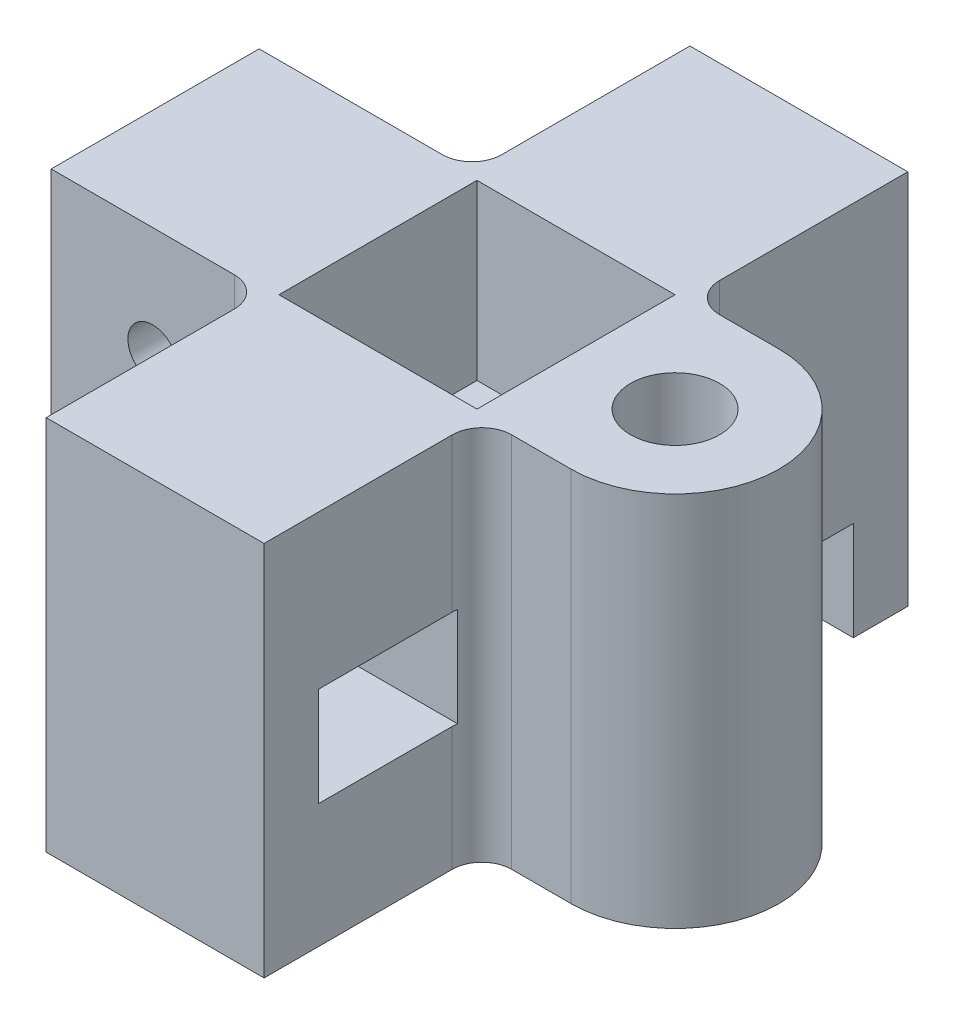
from build123d import *

# Parameters (mm, degrees)
SKETCH1_W               = 65
SKETCH1_H               = 65
SKETCH1_R               = 2.5
BOSS_EXTRUDE1_DEPTH     = 38
SKETCH3_W               = 21.5
SKETCH3_H               = 22
CUT_EXTRUDE2_DEPTH      = 60.636398282
CUT_EXTRUDE3_DEPTH      = 60.636398282
CUT_EXTRUDE3_DEPTH_BACK = 60.636398282
SKETCH4_R               = 2.5
CUT_EXTRUDE4_DEPTH      = 60.636398282
CUT_EXTRUDE4_DEPTH_BACK = 60.636398282
SKETCH6_W               = 14
SKETCH6_H               = 10
SKETCH7_W               = 20
SKETCH7_H               = 20
CUT_EXTRUDE5_DEPTH      = 17.5
FILLET1_R               = 3
SKETCH8_R               = 4.5
CUT_EXTRUDE6_DEPTH      = 23


with BuildPart() as part:
    # Sketch1 → Boss-Extrude1 (new body)
    with BuildSketch(Plane(origin=(0, 0, 0), x_dir=(1, 0, 0), z_dir=(0, 1, 0))):
        Rectangle(SKETCH1_W, SKETCH1_H)
        with Locations(Location((0, 0, 0), (0, 0, 270))):
            Circle(SKETCH1_R, mode=Mode.SUBTRACT)
        with Locations(Location((20, 0, 0), (0, 0, 270))):
            Circle(SKETCH1_R, mode=Mode.SUBTRACT)
    extrude(amount=BOSS_EXTRUDE1_DEPTH)

    # Sketch3 → Cut-Extrude2 (cut, through all)
    with BuildSketch(Plane(origin=(0, 38, 0), x_dir=(1, 0, 0), z_dir=(0, 1, 0))):
        with Locations((-21.75, 21.5)):
            Rectangle(SKETCH3_W, SKETCH3_H)
        with BuildLine():
            Line((11, 32.5), (32.5, 32.5))
            Line((32.5, 32.5), (32.5, -32.5))
            Line((32.5, -32.5), (11, -32.5))
            Line((11, -32.5), (11, -10.5))
            Line((11, -10.5), (20, -10.5))
            ThreePointArc((20, -10.5), (30.5, 0), (20, 10.5))
            Line((20, 10.5), (11, 10.5))
            Line((11, 10.5), (11, 32.5))
        make_face()
        with Locations((-21.75, -21.5)):
            Rectangle(SKETCH3_W, SKETCH3_H)
    extrude(amount=-CUT_EXTRUDE2_DEPTH, mode=Mode.SUBTRACT)

    # Sketch4 → Cut-Extrude3 (cut, two sides: drawn at the far end of the back side and taken through both)
    with BuildSketch(Plane.XY.offset(-CUT_EXTRUDE3_DEPTH_BACK)):
        with Locations((-22.25, 27)):
            Circle(SKETCH4_R)
    extrude(amount=CUT_EXTRUDE3_DEPTH + CUT_EXTRUDE3_DEPTH_BACK, mode=Mode.SUBTRACT)

    # Sketch6 → Cut-Extrude4 (cut, two sides: drawn at the far end of the back side and taken through both)
    with BuildSketch(Plane(origin=(0, 0, 0), x_dir=(0, 0, -1), z_dir=(1, 0, 0)).offset(-CUT_EXTRUDE4_DEPTH_BACK)):
        with Locations((-20, 17.5)):
            Rectangle(SKETCH6_W, SKETCH6_H)
        with Locations((20, 5)):
            Rectangle(SKETCH6_W, SKETCH6_H)
    extrude(amount=CUT_EXTRUDE4_DEPTH + CUT_EXTRUDE4_DEPTH_BACK, mode=Mode.SUBTRACT)

    # Sketch7 → Cut-Extrude5 (cut)
    with BuildSketch(Plane(origin=(0, 38, 0), x_dir=(1, 0, 0), z_dir=(0, 1, 0))):
        Rectangle(SKETCH7_W, SKETCH7_H)
    extrude(amount=-CUT_EXTRUDE5_DEPTH, mode=Mode.SUBTRACT)

    # Fillet1
    # the kernel refuses this fillet: 3 mm, written as the material it adds along each edge
    with BuildSketch(Plane(origin=(11, 38, -10.5), x_dir=(0, 0, -1), z_dir=(0, -1, 0))) as fillet1_piece_1_section:
        with BuildLine():
            CenterArc((FILLET1_R, FILLET1_R), FILLET1_R, 180, 90)
            Line((0, FILLET1_R), (0, 0))
            Line((0, 0), (FILLET1_R, 0))
        make_face()
    fillet1_piece_1 = extrude(amount=38, mode=Mode.PRIVATE)
    fillet1_piece_1 = split(fillet1_piece_1, bisect_by=Plane(origin=(10.978029732, 10, -13.226390424), z_dir=(0, 1, 0)), keep=Keep.TOP, mode=Mode.PRIVATE)
    fillet1_piece_1 = split(fillet1_piece_1, bisect_by=Plane(origin=(10.978029732, 24, -13), z_dir=(0, 0, -1)), keep=Keep.TOP, mode=Mode.PRIVATE)
    add(fillet1_piece_1)
    with BuildSketch(Plane(origin=(11, 38, -10.5), x_dir=(0, 0, -1), z_dir=(0, -1, 0))) as fillet1_piece_2_section:
        with BuildLine():
            CenterArc((FILLET1_R, FILLET1_R), FILLET1_R, 180, 90)
            Line((0, FILLET1_R), (0, 0))
            Line((0, 0), (FILLET1_R, 0))
        make_face()
    fillet1_piece_2 = extrude(amount=38, mode=Mode.PRIVATE)
    fillet1_piece_2 = split(fillet1_piece_2, bisect_by=Plane(origin=(11.690666213, 10, -11.145663974), z_dir=(0, 1, 0)), keep=Keep.TOP, mode=Mode.PRIVATE)
    fillet1_piece_2 = split(fillet1_piece_2, bisect_by=Plane(origin=(11.690666213, 24, -13), z_dir=(0, 0, 1)), keep=Keep.TOP, mode=Mode.PRIVATE)
    add(fillet1_piece_2)
    with BuildSketch(Plane(origin=(11, 38, -10.5), x_dir=(0, 0, -1), z_dir=(0, -1, 0))) as fillet1_piece_3_section:
        with BuildLine():
            CenterArc((FILLET1_R, FILLET1_R), FILLET1_R, 180, 90)
            Line((0, FILLET1_R), (0, 0))
            Line((0, 0), (FILLET1_R, 0))
        make_face()
    fillet1_piece_3 = extrude(amount=38, mode=Mode.PRIVATE)
    fillet1_piece_3 = split(fillet1_piece_3, bisect_by=Plane(origin=(11.690666213, 10, -11.145663974), z_dir=(0, -1, 0)), keep=Keep.TOP, mode=Mode.PRIVATE)
    fillet1_piece_3 = split(fillet1_piece_3, bisect_by=Plane(origin=(11.690666213, 5, -13), z_dir=(0, 0, 1)), keep=Keep.TOP, mode=Mode.PRIVATE)
    add(fillet1_piece_3)
    with BuildSketch(Plane(origin=(11, 38, 10.5), x_dir=(1, 0, 0), z_dir=(0, -1, 0))) as fillet1_piece_4_section:
        with BuildLine():
            CenterArc((FILLET1_R, FILLET1_R), FILLET1_R, 180, 90)
            Line((0, FILLET1_R), (0, 0))
            Line((0, 0), (FILLET1_R, 0))
        make_face()
    fillet1_piece_4 = extrude(amount=38, mode=Mode.PRIVATE)
    fillet1_piece_4 = split(fillet1_piece_4, bisect_by=Plane(origin=(11.690666213, 22.5, 11.145663974), z_dir=(0, 1, 0)), keep=Keep.TOP, mode=Mode.PRIVATE)
    fillet1_piece_4 = split(fillet1_piece_4, bisect_by=Plane(origin=(11.690666213, 30.25, 13), z_dir=(0, 0, -1)), keep=Keep.TOP, mode=Mode.PRIVATE)
    add(fillet1_piece_4)
    with BuildSketch(Plane(origin=(11, 38, 10.5), x_dir=(1, 0, 0), z_dir=(0, -1, 0))) as fillet1_piece_5_section:
        with BuildLine():
            CenterArc((FILLET1_R, FILLET1_R), FILLET1_R, 180, 90)
            Line((0, FILLET1_R), (0, 0))
            Line((0, 0), (FILLET1_R, 0))
        make_face()
    fillet1_piece_5 = extrude(amount=38, mode=Mode.PRIVATE)
    fillet1_piece_5 = split(fillet1_piece_5, bisect_by=Plane(origin=(10.978029732, 22.5, 13.226390424), z_dir=(0, 1, 0)), keep=Keep.TOP, mode=Mode.PRIVATE)
    fillet1_piece_5 = split(fillet1_piece_5, bisect_by=Plane(origin=(10.978029732, 30.25, 13), z_dir=(0, 0, 1)), keep=Keep.TOP, mode=Mode.PRIVATE)
    add(fillet1_piece_5)
    with BuildSketch(Plane(origin=(11, 38, 10.5), x_dir=(1, 0, 0), z_dir=(0, -1, 0))) as fillet1_piece_6_section:
        with BuildLine():
            CenterArc((FILLET1_R, FILLET1_R), FILLET1_R, 180, 90)
            Line((0, FILLET1_R), (0, 0))
            Line((0, 0), (FILLET1_R, 0))
        make_face()
    fillet1_piece_6 = extrude(amount=38, mode=Mode.PRIVATE)
    fillet1_piece_6 = split(fillet1_piece_6, bisect_by=Plane(origin=(11.690666213, 22.5, 11.145663974), z_dir=(0, -1, 0)), keep=Keep.TOP, mode=Mode.PRIVATE)
    fillet1_piece_6 = split(fillet1_piece_6, bisect_by=Plane(origin=(11.690666213, 12.5, 11.145663974), z_dir=(0, 1, 0)), keep=Keep.TOP, mode=Mode.PRIVATE)
    fillet1_piece_6 = split(fillet1_piece_6, bisect_by=Plane(origin=(11.690666213, 17.5, 13), z_dir=(0, 0, -1)), keep=Keep.TOP, mode=Mode.PRIVATE)
    add(fillet1_piece_6)
    with BuildSketch(Plane(origin=(11, 38, 10.5), x_dir=(1, 0, 0), z_dir=(0, -1, 0))) as fillet1_piece_7_section:
        with BuildLine():
            CenterArc((FILLET1_R, FILLET1_R), FILLET1_R, 180, 90)
            Line((0, FILLET1_R), (0, 0))
            Line((0, 0), (FILLET1_R, 0))
        make_face()
    fillet1_piece_7 = extrude(amount=38, mode=Mode.PRIVATE)
    fillet1_piece_7 = split(fillet1_piece_7, bisect_by=Plane(origin=(11.690666213, 12.5, 11.145663974), z_dir=(0, -1, 0)), keep=Keep.TOP, mode=Mode.PRIVATE)
    fillet1_piece_7 = split(fillet1_piece_7, bisect_by=Plane(origin=(11.690666213, 6.25, 13), z_dir=(0, 0, -1)), keep=Keep.TOP, mode=Mode.PRIVATE)
    add(fillet1_piece_7)
    with BuildSketch(Plane(origin=(11, 38, 10.5), x_dir=(1, 0, 0), z_dir=(0, -1, 0))) as fillet1_piece_8_section:
        with BuildLine():
            CenterArc((FILLET1_R, FILLET1_R), FILLET1_R, 180, 90)
            Line((0, FILLET1_R), (0, 0))
            Line((0, 0), (FILLET1_R, 0))
        make_face()
    fillet1_piece_8 = extrude(amount=38, mode=Mode.PRIVATE)
    fillet1_piece_8 = split(fillet1_piece_8, bisect_by=Plane(origin=(10.978029732, 12.5, 13.226390424), z_dir=(0, -1, 0)), keep=Keep.TOP, mode=Mode.PRIVATE)
    fillet1_piece_8 = split(fillet1_piece_8, bisect_by=Plane(origin=(10.978029732, 6.25, 13), z_dir=(0, 0, 1)), keep=Keep.TOP, mode=Mode.PRIVATE)
    add(fillet1_piece_8)
    with BuildSketch(Plane(origin=(-11, 38, 10.5), x_dir=(-1, 0, 0), z_dir=(0, -1, 0))) as fillet1_piece_9_section:
        with BuildLine():
            CenterArc((FILLET1_R, -FILLET1_R), FILLET1_R, 90, 90)
            Line((0, -FILLET1_R), (0, 0))
            Line((0, 0), (FILLET1_R, 0))
        make_face()
    fillet1_piece_9 = extrude(amount=38, mode=Mode.PRIVATE)
    fillet1_piece_9 = split(fillet1_piece_9, bisect_by=Plane(origin=(-11.690666213, 22.5, 11.145663974), z_dir=(0, 1, 0)), keep=Keep.TOP, mode=Mode.PRIVATE)
    fillet1_piece_9 = split(fillet1_piece_9, bisect_by=Plane(origin=(-11.690666213, 30.25, 13), z_dir=(0, 0, -1)), keep=Keep.TOP, mode=Mode.PRIVATE)
    add(fillet1_piece_9)
    with BuildSketch(Plane(origin=(-11, 38, 10.5), x_dir=(-1, 0, 0), z_dir=(0, -1, 0))) as fillet1_piece_10_section:
        with BuildLine():
            CenterArc((FILLET1_R, -FILLET1_R), FILLET1_R, 90, 90)
            Line((0, -FILLET1_R), (0, 0))
            Line((0, 0), (FILLET1_R, 0))
        make_face()
    fillet1_piece_10 = extrude(amount=38, mode=Mode.PRIVATE)
    fillet1_piece_10 = split(fillet1_piece_10, bisect_by=Plane(origin=(-10.978029732, 22.5, 13.226390424), z_dir=(0, 1, 0)), keep=Keep.TOP, mode=Mode.PRIVATE)
    fillet1_piece_10 = split(fillet1_piece_10, bisect_by=Plane(origin=(-10.978029732, 30.25, 13), z_dir=(0, 0, 1)), keep=Keep.TOP, mode=Mode.PRIVATE)
    add(fillet1_piece_10)
    with BuildSketch(Plane(origin=(-11, 38, 10.5), x_dir=(-1, 0, 0), z_dir=(0, -1, 0))) as fillet1_piece_11_section:
        with BuildLine():
            CenterArc((FILLET1_R, -FILLET1_R), FILLET1_R, 90, 90)
            Line((0, -FILLET1_R), (0, 0))
            Line((0, 0), (FILLET1_R, 0))
        make_face()
    fillet1_piece_11 = extrude(amount=38, mode=Mode.PRIVATE)
    fillet1_piece_11 = split(fillet1_piece_11, bisect_by=Plane(origin=(-11.690666213, 22.5, 11.145663974), z_dir=(0, -1, 0)), keep=Keep.TOP, mode=Mode.PRIVATE)
    fillet1_piece_11 = split(fillet1_piece_11, bisect_by=Plane(origin=(-11.690666213, 17.5, 13), z_dir=(0, 0, -1)), keep=Keep.TOP, mode=Mode.PRIVATE)
    fillet1_piece_11 = split(fillet1_piece_11, bisect_by=Plane(origin=(-11.690666213, 12.5, 11.145663974), z_dir=(0, 1, 0)), keep=Keep.TOP, mode=Mode.PRIVATE)
    add(fillet1_piece_11)
    with BuildSketch(Plane(origin=(-11, 38, 10.5), x_dir=(-1, 0, 0), z_dir=(0, -1, 0))) as fillet1_piece_12_section:
        with BuildLine():
            CenterArc((FILLET1_R, -FILLET1_R), FILLET1_R, 90, 90)
            Line((0, -FILLET1_R), (0, 0))
            Line((0, 0), (FILLET1_R, 0))
        make_face()
    fillet1_piece_12 = extrude(amount=38, mode=Mode.PRIVATE)
    fillet1_piece_12 = split(fillet1_piece_12, bisect_by=Plane(origin=(-11.690666213, 6.25, 13), z_dir=(0, 0, -1)), keep=Keep.TOP, mode=Mode.PRIVATE)
    fillet1_piece_12 = split(fillet1_piece_12, bisect_by=Plane(origin=(-11.690666213, 12.5, 11.145663974), z_dir=(0, -1, 0)), keep=Keep.TOP, mode=Mode.PRIVATE)
    add(fillet1_piece_12)
    with BuildSketch(Plane(origin=(-11, 38, 10.5), x_dir=(-1, 0, 0), z_dir=(0, -1, 0))) as fillet1_piece_13_section:
        with BuildLine():
            CenterArc((FILLET1_R, -FILLET1_R), FILLET1_R, 90, 90)
            Line((0, -FILLET1_R), (0, 0))
            Line((0, 0), (FILLET1_R, 0))
        make_face()
    fillet1_piece_13 = extrude(amount=38, mode=Mode.PRIVATE)
    fillet1_piece_13 = split(fillet1_piece_13, bisect_by=Plane(origin=(-10.978029732, 6.25, 13), z_dir=(0, 0, 1)), keep=Keep.TOP, mode=Mode.PRIVATE)
    fillet1_piece_13 = split(fillet1_piece_13, bisect_by=Plane(origin=(-10.978029732, 12.5, 13.226390424), z_dir=(0, -1, 0)), keep=Keep.TOP, mode=Mode.PRIVATE)
    add(fillet1_piece_13)
    with BuildSketch(Plane(origin=(-11, 38, -10.5), x_dir=(0, 0, -1), z_dir=(0, -1, 0))) as fillet1_piece_14_section:
        with BuildLine():
            CenterArc((FILLET1_R, -FILLET1_R), FILLET1_R, 90, 90)
            Line((0, -FILLET1_R), (0, 0))
            Line((0, 0), (FILLET1_R, 0))
        make_face()
    fillet1_piece_14 = extrude(amount=38, mode=Mode.PRIVATE)
    fillet1_piece_14 = split(fillet1_piece_14, bisect_by=Plane(origin=(-10.978029732, 10, -13.226390424), z_dir=(0, 1, 0)), keep=Keep.TOP, mode=Mode.PRIVATE)
    fillet1_piece_14 = split(fillet1_piece_14, bisect_by=Plane(origin=(-10.978029732, 24, -13), z_dir=(0, 0, -1)), keep=Keep.TOP, mode=Mode.PRIVATE)
    add(fillet1_piece_14)
    with BuildSketch(Plane(origin=(-11, 38, -10.5), x_dir=(0, 0, -1), z_dir=(0, -1, 0))) as fillet1_piece_15_section:
        with BuildLine():
            CenterArc((FILLET1_R, -FILLET1_R), FILLET1_R, 90, 90)
            Line((0, -FILLET1_R), (0, 0))
            Line((0, 0), (FILLET1_R, 0))
        make_face()
    fillet1_piece_15 = extrude(amount=38, mode=Mode.PRIVATE)
    fillet1_piece_15 = split(fillet1_piece_15, bisect_by=Plane(origin=(-11.690666213, 10, -11.145663974), z_dir=(0, 1, 0)), keep=Keep.TOP, mode=Mode.PRIVATE)
    fillet1_piece_15 = split(fillet1_piece_15, bisect_by=Plane(origin=(-11.690666213, 24, -13), z_dir=(0, 0, 1)), keep=Keep.TOP, mode=Mode.PRIVATE)
    add(fillet1_piece_15)
    with BuildSketch(Plane(origin=(-11, 38, -10.5), x_dir=(0, 0, -1), z_dir=(0, -1, 0))) as fillet1_piece_16_section:
        with BuildLine():
            CenterArc((FILLET1_R, -FILLET1_R), FILLET1_R, 90, 90)
            Line((0, -FILLET1_R), (0, 0))
            Line((0, 0), (FILLET1_R, 0))
        make_face()
    fillet1_piece_16 = extrude(amount=38, mode=Mode.PRIVATE)
    fillet1_piece_16 = split(fillet1_piece_16, bisect_by=Plane(origin=(-11.690666213, 10, -11.145663974), z_dir=(0, -1, 0)), keep=Keep.TOP, mode=Mode.PRIVATE)
    fillet1_piece_16 = split(fillet1_piece_16, bisect_by=Plane(origin=(-11.690666213, 5, -13), z_dir=(0, 0, 1)), keep=Keep.TOP, mode=Mode.PRIVATE)
    add(fillet1_piece_16)

    # Sketch8 → Cut-Extrude6 (cut)
    with BuildSketch(Plane(origin=(0, 38, 0), x_dir=(1, 0, 0), z_dir=(0, 1, 0))):
        with Locations(Location((20, 0, 0), (0, 0, 270))):
            Circle(SKETCH8_R)
        with Locations(Location((0, 0, 0), (0, 0, 270))):
            Circle(SKETCH8_R)
    extrude(amount=-CUT_EXTRUDE6_DEPTH, mode=Mode.SUBTRACT)


solid = part.part
